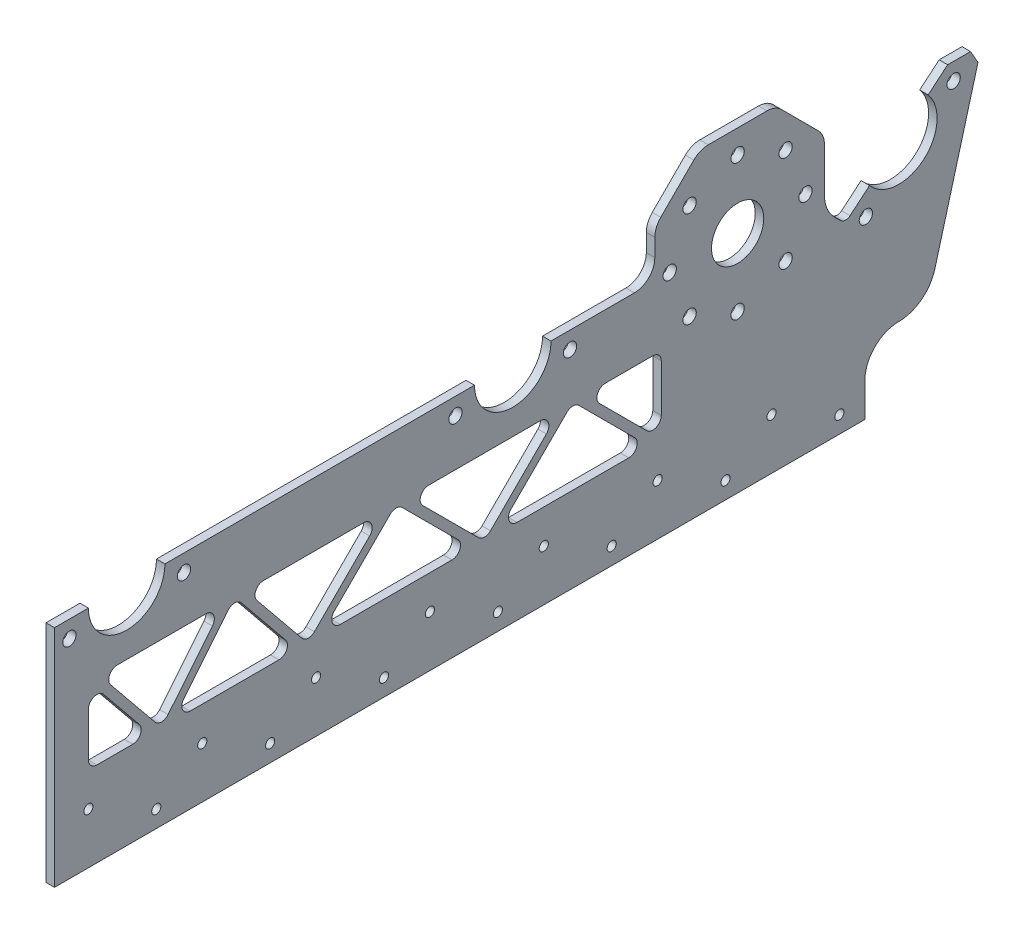
from build123d import *

# Parameters (mm, degrees)
SKETCH1_R                        = 9.779
SKETCH1_R_2                      = 2.413
BOSS_EXTRUDE1_DEPTH              = 3.175
F_10_CLEARANCE_HOLE1_D           = 4.9784
F_10_CLEARANCE_HOLE2_D           = 4.9784
F_10_CLEARANCE_HOLE2_DEPTH       = 3.175
F_10_CLEARANCE_HOLE2_TIP         = 1.495662253
CHAMFER1_SIZE                    = 5.08
CHAMFER1_SIZE2                   = 4.1342197
FILLET1_R                        = 7.62
F_1_8_0_135_DIAMETER_HOLE1_D     = 3.429
F_1_8_0_135_DIAMETER_HOLE1_DEPTH = 16.51
F_1_8_0_135_DIAMETER_HOLE1_TIP   = 1.030175531
CUT_EXTRUDE1_DEPTH               = 334.142113868
FILLET2_R                        = 3.175


with BuildPart() as part:
    # Sketch1 → Boss-Extrude1 (new body)
    with BuildSketch(Plane(origin=(0, 0, 0), x_dir=(0, 0, -1), z_dir=(1, 0, 0))):
        with BuildLine():
            Line((-12.7, -12.7), (-315.9379, -12.7))
            Line((-315.9379, -12.7), (-315.9379, 71.4629))
            Line((-315.9379, 71.4629), (-303.2379, 71.4629))
            ThreePointArc((-303.2379, 71.4629), (-288.925, 57.15), (-274.6121, 71.4629))
            Line((-274.6121, 71.4629), (-158.7754, 71.4629))
            ThreePointArc((-158.7754, 71.4629), (-144.4625, 57.15), (-130.1496, 71.4629))
            Line((-130.1496, 71.4629), (-91.313, 71.4629))
            Line((-91.313, 71.4629), (-91.313, 88.788677931))
            Line((-91.313, 88.788677931), (-74.475777931, 105.6259))
            Line((-74.475777931, 105.6259), (-46.174222069, 105.6259))
            Line((-46.174222069, 105.6259), (-27.855333333, 87.307011265))
            Line((-27.855333333, 87.307011265), (-27.855333333, 67.615437998))
            ThreePointArc((-27.855333333, 67.615437998), (-26.836905275, 62.632379001), (-23.944959008, 58.448514823))
            Line((-23.944959008, 58.448514823), (-21.653228214, 56.251108404))
            ThreePointArc((-21.653228214, 56.251108404), (-19.979435171, 55.545886769), (-18.262622551, 56.138740153))
            Line((-18.262622551, 56.138740153), (-10.96431751, 62.262745221))
            ThreePointArc((-10.96431751, 62.262745221), (9.200154779, 60.49858249), (10.96431751, 80.663054779))
            Line((10.96431751, 80.663054779), (18.262622551, 86.787059847))
            Line((18.262622551, 86.787059847), (30.962622551, 86.787059847))
            Line((30.962622551, 86.787059847), (13.473085073, 22.977185543))
            ThreePointArc((13.473085073, 22.977185543), (8.472670241, 15.562580904), (0, 12.7))
            ThreePointArc((0, 12.7), (-8.980256121, 8.980256121), (-12.7, 0))
            Line((-12.7, 0), (-12.7, -12.7))
        make_face()
        with Locations((-60.325, 71.4629)):
            Circle(SKETCH1_R, mode=Mode.SUBTRACT)
        with Locations((-60.325, 96.8629)):
            Circle(SKETCH1_R_2, mode=Mode.SUBTRACT)
        with Locations((-42.364487758, 89.423412242)):
            Circle(SKETCH1_R_2, mode=Mode.SUBTRACT)
        with Locations((-34.925, 71.4629)):
            Circle(SKETCH1_R_2, mode=Mode.SUBTRACT)
        with Locations((-42.364487758, 53.502387758)):
            Circle(SKETCH1_R_2, mode=Mode.SUBTRACT)
        with Locations((-60.325, 46.0629)):
            Circle(SKETCH1_R_2, mode=Mode.SUBTRACT)
        with Locations((-78.285512242, 53.502387758)):
            Circle(SKETCH1_R_2, mode=Mode.SUBTRACT)
        with Locations((-85.725, 71.4629)):
            Circle(SKETCH1_R_2, mode=Mode.SUBTRACT)
        with Locations((-78.285512242, 89.423412242)):
            Circle(SKETCH1_R_2, mode=Mode.SUBTRACT)
    extrude(amount=BOSS_EXTRUDE1_DEPTH)

    # #10 Clearance Hole1 (through all)
    with Locations(Plane(origin=(3.175, 0, 0), x_dir=(0, 0, -1), z_dir=(1, 0, 0))):
        with Locations((-310.35625, 65.1129), (-267.49375, 65.1129), (-165.89375, 65.1129), (-123.03125, 65.1129), (-12.33558865, 52.822775826), (20.498991293, 80.374259746)):
            Hole(F_10_CLEARANCE_HOLE1_D / 2)

    # #10 Clearance Hole2
    with Locations(Plane(origin=(3.175, 0, 0), x_dir=(0, 0, -1), z_dir=(1, 0, 0))):
        with Locations((-60.325, 96.8629), (-42.364487758, 89.423412242), (-34.925, 71.4629), (-42.364487758, 53.502387758), (-60.325, 46.0629), (-78.285512242, 53.502387758), (-85.725, 71.4629), (-78.285512242, 89.423412242)):
            Hole(F_10_CLEARANCE_HOLE2_D / 2, depth=F_10_CLEARANCE_HOLE2_DEPTH)
            with Locations((0, 0, -(F_10_CLEARANCE_HOLE2_DEPTH + F_10_CLEARANCE_HOLE2_TIP / 2))):  # 118° drill point
                Cone(0, F_10_CLEARANCE_HOLE2_D / 2, F_10_CLEARANCE_HOLE2_TIP, mode=Mode.SUBTRACT)

    # Chamfer1
    chamfer1_edges = [part.edges().sort_by_distance(p)[0] for p in [
        (1.5875, 86.787059847, -30.962622551),
    ]]
    chamfer1_side = [part.faces().sort_by_distance(p)[0] for p in [
        (1.5875, 54.882122695, -22.217853812),
    ]]
    chamfer(chamfer1_edges, length=CHAMFER1_SIZE, length2=CHAMFER1_SIZE2, reference=chamfer1_side[0])

    # Fillet1
    fillet1_edges = [part.edges().sort_by_distance(p)[0] for p in [
        (1.5875, 87.307011265, 27.855333333),
        (1.5875, 105.6259, 46.174222069),
        (1.5875, 105.6259, 74.475777931),
        (1.5875, 88.788677931, 91.313),
        (1.5875, 71.4629, 91.313),
    ]]
    fillet(fillet1_edges, radius=FILLET1_R)

    # 1/8 (0.135) Diameter Hole1
    with Locations(Plane.ZY):
        with Locations((22.2504, -6.35), (47.6504, 6.35), (64.848316667, -6.35), (90.248316667, 6.35), (107.446233333, -6.35), (132.846233333, 6.35), (150.04415, -6.35), (175.44415, 6.35), (192.642066667, -6.35), (218.042066667, 6.35), (235.239983333, -6.35), (260.639983333, 6.35), (277.8379, -6.35), (303.2379, 6.35)):
            Hole(F_1_8_0_135_DIAMETER_HOLE1_D / 2, depth=F_1_8_0_135_DIAMETER_HOLE1_DEPTH)
            with Locations((0, 0, -(F_1_8_0_135_DIAMETER_HOLE1_DEPTH + F_1_8_0_135_DIAMETER_HOLE1_TIP / 2))):  # 118° drill point
                Cone(0, F_1_8_0_135_DIAMETER_HOLE1_D / 2, F_1_8_0_135_DIAMETER_HOLE1_TIP, mode=Mode.SUBTRACT)

    # Sketch9 → Cut-Extrude1 (cut, through all)
    with BuildSketch(Plane(origin=(3.175, 0, 0), x_dir=(0, 0, -1), z_dir=(1, 0, 0))):
        Polygon((-303.2379, 47.625), (-303.2379, 19.05), (-279.973009059, 19.05), align=None)
        Polygon((-299.143661688, 47.625), (-275.878770747, 19.05), (-252.613879806, 47.625), align=None)
        Polygon((-271.784532436, 19.05), (-248.519641495, 47.625), (-225.254750554, 19.05), align=None)
        Polygon((-244.425403183, 47.625), (-221.160512242, 19.05), (-192.585512242, 47.625), align=None)
        Polygon((-216.670384182, 19.05), (-188.095384182, 47.625), (-159.520384182, 19.05), align=None)
        Polygon((-183.605256121, 47.625), (-155.030256121, 19.05), (-126.455256121, 47.625), align=None)
        Polygon((-121.965128061, 47.625), (-150.540128061, 19.05), (-93.390128061, 19.05), align=None)
        Polygon((-117.475, 47.625), (-88.9, 19.05), (-88.9, 47.625), align=None)
    extrude(amount=-CUT_EXTRUDE1_DEPTH, mode=Mode.SUBTRACT)

    # Fillet2
    fillet2_edges = [part.edges().sort_by_distance(p)[0] for p in [
        (1.5875, 19.05, 303.2379),
        (1.5875, 47.625, 303.2379),
        (1.5875, 19.05, 279.973009059),
        (1.5875, 19.05, 150.540128061),
        (1.5875, 47.625, 121.965128061),
        (1.5875, 19.05, 93.390128061),
        (1.5875, 19.05, 155.030256121),
        (1.5875, 47.625, 183.605256121),
        (1.5875, 47.625, 126.455256121),
        (1.5875, 19.05, 88.9),
        (1.5875, 47.625, 117.475),
        (1.5875, 47.625, 88.9),
        (1.5875, 47.625, 248.519641495),
        (1.5875, 19.05, 225.254750554),
        (1.5875, 19.05, 271.784532436),
        (1.5875, 19.05, 275.878770747),
        (1.5875, 47.625, 299.143661688),
        (1.5875, 47.625, 252.613879806),
        (1.5875, 19.05, 159.520384182),
        (1.5875, 19.05, 216.670384182),
        (1.5875, 19.05, 221.160512242),
        (1.5875, 47.625, 244.425403183),
        (1.5875, 47.625, 192.585512242),
        (1.5875, 47.625, 188.095384182),
    ]]
    fillet(fillet2_edges, radius=FILLET2_R)


solid = part.part
